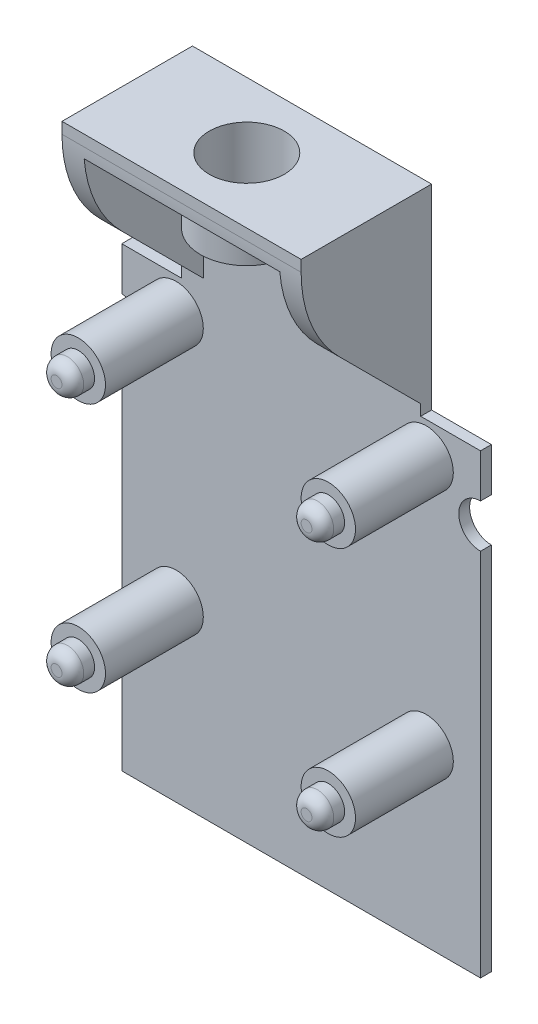
from build123d import *

# Parameters (mm, degrees)
SKIZZE1_R                        = 2.5
AUFSATZ_LINEAR_AUSTRAGEN4_DEPTH  = 1
SKIZZE1_3_R                      = 2.5
SKIZZE1_3_R_2                    = 1.5
AUFSATZ_LINEAR_AUSTRAGEN5_DEPTH  = 10
SKIZZE1_4_R                      = 1.5
AUFSATZ_LINEAR_AUSTRAGEN6_DEPTH  = 12
VERRUNDUNG4_R                    = 1
SKIZZE1_5_W                      = 2
SKIZZE1_5_H                      = 16
AUFSATZ_LINEAR_AUSTRAGEN7_DEPTH  = 12
FASE3_SIZE                       = 12
VERRUNDUNG5_R                    = 12
SCHNITT_LINEAR_AUSTRAGEN2_DEPTH  = 12
SKIZZE5_4_R                      = 4.25
SKIZZE5_4_R_2                    = 3.45
AUFSATZ_LINEAR_AUSTRAGEN10_DEPTH = 6


with BuildPart() as part:
    # Skizze1 → Aufsatz-Linear austragen4 (new body)
    with BuildSketch(Plane.XY):
        with BuildLine():
            Line((-11, 12), (-16.5, 12))
            Line((-16.5, 12), (-16.5, 8))
            ThreePointArc((-16.5, 8), (-14.5, 6), (-16.5, 4))
            Line((-16.5, 4), (-16.5, -30))
            Line((-16.5, -30), (16.5, -30))
            Line((16.5, -30), (16.5, 4))
            ThreePointArc((16.5, 4), (14.5, 6), (16.5, 8))
            Line((16.5, 8), (16.5, 12))
            Line((16.5, 12), (11, 12))
            Line((11, 12), (9, 12))
            Line((9, 12), (9, 28))
            Line((9, 28), (-9, 28))
            Line((-9, 28), (-9, 12))
            Line((-9, 12), (-11, 12))
        make_face()
        with Locations((-11.5, -14)):
            Circle(SKIZZE1_R, mode=Mode.SUBTRACT)
        with Locations((11.5, -14)):
            Circle(SKIZZE1_R, mode=Mode.SUBTRACT)
        with Locations((-11.5, 9)):
            Circle(SKIZZE1_R, mode=Mode.SUBTRACT)
        with Locations((11.5, 9)):
            Circle(SKIZZE1_R, mode=Mode.SUBTRACT)
    extrude(amount=AUFSATZ_LINEAR_AUSTRAGEN4_DEPTH)

    # Skizze1<3> → Aufsatz-Linear austragen5 (add)
    # profile 1 of 4: a face of its own
    with BuildSketch(Plane.XY):
        with Locations((11.5, 9)):
            Circle(SKIZZE1_3_R)
        with Locations((11.5, 9)):
            Circle(SKIZZE1_3_R_2, mode=Mode.SUBTRACT)
    # profile 2 of 4: a face of its own
    with BuildSketch(Plane.XY):
        with Locations((-11.5, 9)):
            Circle(SKIZZE1_3_R)
        with Locations((-11.5, 9)):
            Circle(SKIZZE1_3_R_2, mode=Mode.SUBTRACT)
    # profile 3 of 4: a face of its own
    with BuildSketch(Plane.XY):
        with Locations((-11.5, -14)):
            Circle(SKIZZE1_3_R)
        with Locations((-11.5, -14)):
            Circle(SKIZZE1_3_R_2, mode=Mode.SUBTRACT)
    # profile 4 of 4: a face of its own
    with BuildSketch(Plane.XY):
        with Locations((11.5, -14)):
            Circle(SKIZZE1_3_R)
        with Locations((11.5, -14)):
            Circle(SKIZZE1_3_R_2, mode=Mode.SUBTRACT)
    extrude(amount=AUFSATZ_LINEAR_AUSTRAGEN5_DEPTH)

    # Skizze1<4> → Aufsatz-Linear austragen6 (add)
    with BuildSketch(Plane.XY):
        with Locations((-11.5, 9)):
            Circle(SKIZZE1_4_R)
        with Locations((11.5, 9)):
            Circle(SKIZZE1_4_R)
        with Locations((-11.5, -14)):
            Circle(SKIZZE1_4_R)
        with Locations((11.5, -14)):
            Circle(SKIZZE1_4_R)
    extrude(amount=AUFSATZ_LINEAR_AUSTRAGEN6_DEPTH)

    # Verrundung4
    verrundung4_edges = [part.edges().sort_by_distance(p)[0] for p in [
        (-13, 9, 12),
        (10, 9, 12),
        (-13, -14, 12),
        (10, -14, 12),
    ]]
    fillet(verrundung4_edges, radius=VERRUNDUNG4_R)

    # Skizze1<5> → Aufsatz-Linear austragen7 (add)
    with BuildSketch(Plane.XY):
        with Locations((-10, 20)):
            Rectangle(SKIZZE1_5_W, SKIZZE1_5_H)
        Polygon((11, 30), (-11, 30), (-11, 28), (-9, 28), (9, 28), (11, 28), align=None)
        with Locations((10, 20)):
            Rectangle(SKIZZE1_5_W, SKIZZE1_5_H)
    extrude(amount=AUFSATZ_LINEAR_AUSTRAGEN7_DEPTH)

    # Fase3
    # the kernel refuses this chamfer: 12 mm, written as the material it takes off along each edge
    with BuildSketch(Plane(origin=(-41.860195856, 12, 12), x_dir=(0, -0.027495876610586348, -0.9996219169112968), z_dir=(1, 0, 0))) as fase3_piece_1_section:
        Polygon((FASE3_SIZE * 0.999621916911, FASE3_SIZE * 0.0274958766106), (-FASE3_SIZE * 0.0274958766106, FASE3_SIZE * 0.999621916911), (0, 0), align=None)
    fase3_piece_1 = extrude(amount=63.720391711, mode=Mode.PRIVATE)
    fase3_piece_1 = split(fase3_piece_1, bisect_by=Plane(origin=(-10, 16.015873454, 1), z_dir=(0, 0, 1)), keep=Keep.TOP, mode=Mode.PRIVATE)
    add(fase3_piece_1, mode=Mode.SUBTRACT)
    with BuildSketch(Plane(origin=(-21.860195856, 12, 12), x_dir=(0, -0.027495876610586348, -0.9996219169112968), z_dir=(1, 0, 0))) as fase3_piece_2_section:
        Polygon((FASE3_SIZE * 0.999621916911, FASE3_SIZE * 0.0274958766106), (-FASE3_SIZE * 0.0274958766106, FASE3_SIZE * 0.999621916911), (0, 0), align=None)
    fase3_piece_2 = extrude(amount=63.720391711, mode=Mode.PRIVATE)
    fase3_piece_2 = split(fase3_piece_2, bisect_by=Plane(origin=(10, 16.015873454, 1), z_dir=(0, 0, 1)), keep=Keep.TOP, mode=Mode.PRIVATE)
    add(fase3_piece_2, mode=Mode.SUBTRACT)

    # Verrundung5
    verrundung5_edges = [part.edges().sort_by_distance(p)[0] for p in [
        (-10, 24, 12),
    ]]
    fillet(verrundung5_edges, radius=VERRUNDUNG5_R)

    # Skizze5 → Schnitt-Linear austragen2 (cut)
    with BuildSketch(Plane(origin=(0, 30, 0), x_dir=(1, 0, 0), z_dir=(0, 1, 0))):
        with BuildLine():
            ThreePointArc((3.45, -6), (2.439518395, -3.560481605), (0, -2.55))
            Line((0, -2.55), (0, -9.45))
            ThreePointArc((0, -9.45), (2.439518395, -8.439518395), (3.45, -6))
        make_face()
        with BuildLine():
            Line((0, -9.45), (0, -2.55))
            ThreePointArc((0, -2.55), (-3.45, -6), (0, -9.45))
        make_face()
    extrude(amount=-SCHNITT_LINEAR_AUSTRAGEN2_DEPTH, mode=Mode.SUBTRACT)

    # Skizze5<4> → Aufsatz-Linear austragen10 (add)
    with BuildSketch(Plane(origin=(0, 30, 0), x_dir=(1, 0, 0), z_dir=(0, 1, 0))):
        with Locations(Location((0, -6, 0), (0, 0, 270))):
            Circle(SKIZZE5_4_R)
        with Locations(Location((0, -6, 0), (0, 0, 270))):
            Circle(SKIZZE5_4_R_2, mode=Mode.SUBTRACT)
    extrude(amount=-AUFSATZ_LINEAR_AUSTRAGEN10_DEPTH)


solid = part.part
